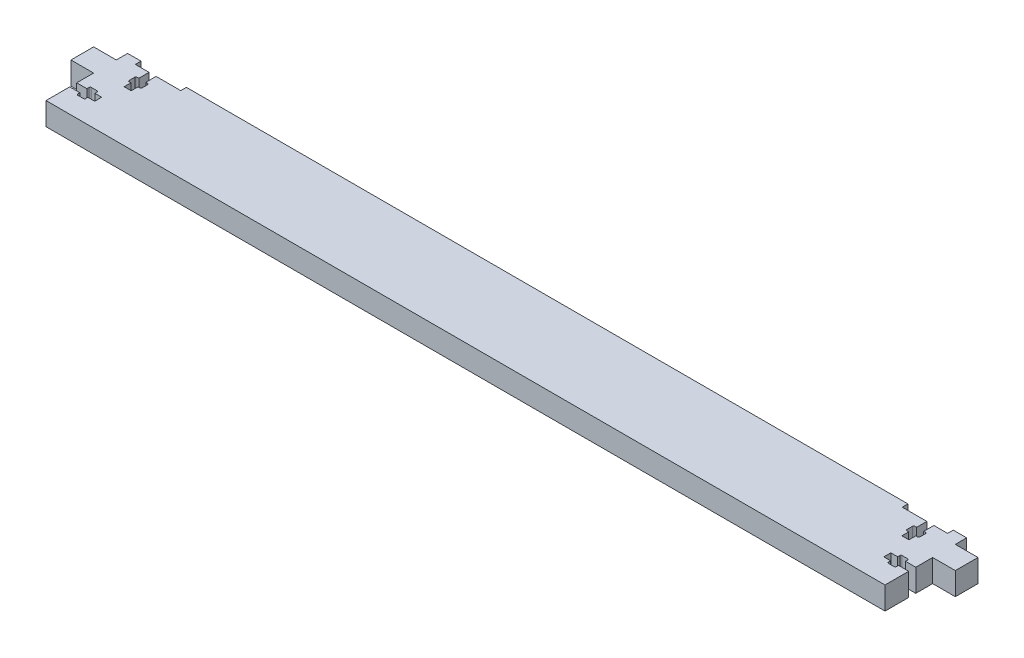
from build123d import *

# Parameters (mm, degrees)
MAINSHAPE_DEPTH    = 10
SKETCH15_W         = 20
SKETCH15_H         = 5
CUT_EXTRUDE6_DEPTH = 197.084165602
SCREWSLOTS_DEPTH   = 197.084165602


with BuildPart() as part:
    # Sketch1 → MainShape (new body)
    with BuildSketch(Plane(origin=(0, 0, 0), x_dir=(1, 0, 0), z_dir=(0, 1, 0))):
        Polygon((0, 18), (-185, 18), (-185, 13), (-195, 13), (-195, 3), (-185, 3), (-185, -18), (0, -18), align=None)
    mainshape = extrude(amount=MAINSHAPE_DEPTH)

    # Sketch15 → Cut-Extrude6 (cut, through all)
    with BuildSketch(Plane(origin=(0, 10, 0), x_dir=(1, 0, 0), z_dir=(0, 1, 0))):
        with Locations((-169.1, 18)):
            Rectangle(SKETCH15_W, SKETCH15_H)
    cut_extrude6 = extrude(amount=-CUT_EXTRUDE6_DEPTH, mode=Mode.SUBTRACT)

    # Sketch2 → ScrewSlots (cut, through all)
    with BuildSketch(Plane(origin=(0, 10, 0), x_dir=(1, 0, 0), z_dir=(0, 1, 0))):
        with BuildLine():
            Line((-173.05, 15.5), (-173.05, 11))
            Line((-173.05, 11), (-173.85, 11))
            ThreePointArc((-173.85, 11), (-174.203553391, 10.853553391), (-174.35, 10.5))
            Line((-174.35, 10.5), (-174.35, 8))
            ThreePointArc((-174.35, 8), (-174.203553391, 7.646446609), (-173.85, 7.5))
            Line((-173.85, 7.5), (-173.05, 7.5))
            Line((-173.05, 7.5), (-173.05, 4.5))
            Line((-173.05, 4.5), (-169.95, 4.5))
            Line((-169.95, 4.5), (-169.95, 7.5))
            Line((-169.95, 7.5), (-169.15, 7.5))
            ThreePointArc((-169.15, 7.5), (-168.796446609, 7.646446609), (-168.65, 8))
            Line((-168.65, 8), (-168.65, 10.5))
            ThreePointArc((-168.65, 10.5), (-168.796446609, 10.853553391), (-169.15, 11))
            Line((-169.15, 11), (-169.95, 11))
            Line((-169.95, 11), (-169.95, 15.5))
            Line((-169.95, 15.5), (-173.05, 15.5))
        make_face()
        with BuildLine():
            Line((-174, -7.55), (-174, -4.45))
            Line((-174, -4.45), (-177, -4.45))
            Line((-177, -4.45), (-177, -3.5))
            ThreePointArc((-177, -3.5), (-177.146446609, -3.146446609), (-177.5, -3))
            Line((-177.5, -3), (-180, -3))
            ThreePointArc((-180, -3), (-180.353553391, -3.146446609), (-180.5, -3.5))
            Line((-180.5, -3.5), (-180.5, -4.45))
            Line((-180.5, -4.45), (-185, -4.45))
            Line((-185, -4.45), (-185, -7.55))
            Line((-185, -7.55), (-180.5, -7.55))
            Line((-180.5, -7.55), (-180.5, -8.5))
            ThreePointArc((-180.5, -8.5), (-180.353553391, -8.853553391), (-180, -9))
            Line((-180, -9), (-177.5, -9))
            ThreePointArc((-177.5, -9), (-177.146446609, -8.853553391), (-177, -8.5))
            Line((-177, -8.5), (-177, -7.55))
            Line((-177, -7.55), (-174, -7.55))
        make_face()
    screwslots = extrude(amount=-SCREWSLOTS_DEPTH, mode=Mode.SUBTRACT)

    # Mirror1: MainShape, Cut-Extrude6, ScrewSlots across plane
    add(mainshape.mirror(Plane(origin=(0, 0, 0), x_dir=(0, 0, 1), z_dir=(1, 0, 0))))
    add(cut_extrude6.mirror(Plane(origin=(0, 0, 0), x_dir=(0, 0, 1), z_dir=(1, 0, 0))), mode=Mode.SUBTRACT)
    add(screwslots.mirror(Plane(origin=(0, 0, 0), x_dir=(0, 0, 1), z_dir=(1, 0, 0))), mode=Mode.SUBTRACT)


solid = part.part
